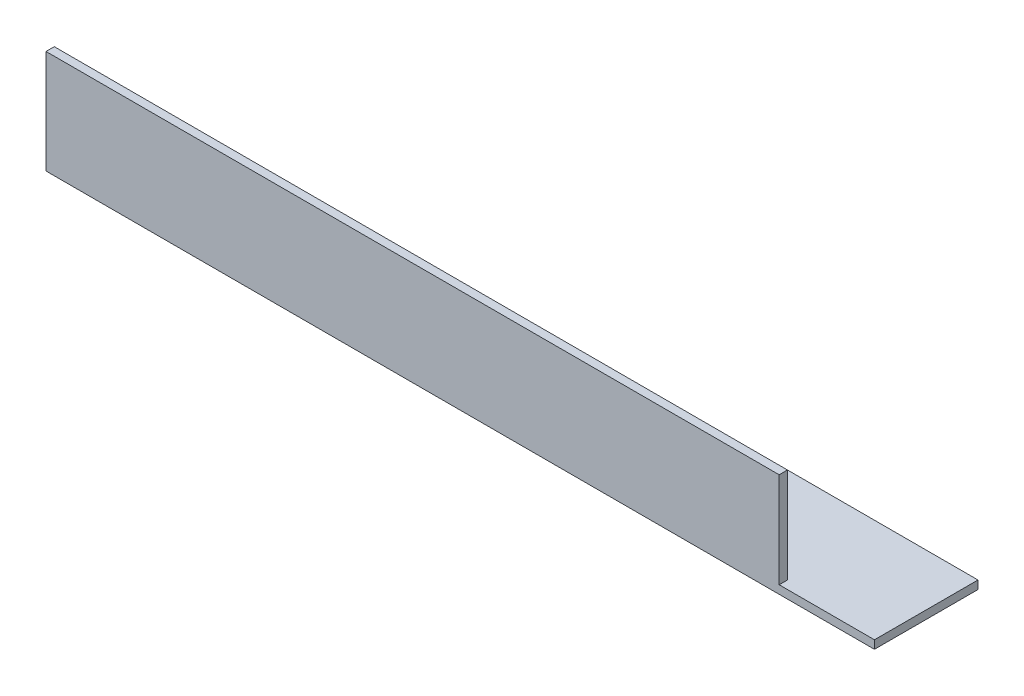
from build123d import *

# Parameters (mm, degrees)
EXTRUDE_1_DEPTH     = 200
SKETCH_3_W          = 23
SKETCH_3_H          = 23
CUT_EXTRUDE_1_DEPTH = 204.100960116


with BuildPart() as part:
    # Эскиз1 → Вытянуть-Тонкостенный1 (new body)
    with BuildSketch(Plane(origin=(0, 0, 0), x_dir=(0, 0, -1), z_dir=(1, 0, 0))):
        Polygon((0, 25), (0, 0), (25, 0), (25, 2), (2, 2), (2, 25), align=None)
    extrude(amount=EXTRUDE_1_DEPTH)

    # Эскиз3 → Вырез-Вытянуть1 (cut, through all)
    with BuildSketch(Plane.XY):
        with Locations((188.5, 13.5)):
            Rectangle(SKETCH_3_W, SKETCH_3_H)
    extrude(amount=-CUT_EXTRUDE_1_DEPTH, mode=Mode.SUBTRACT)


solid = part.part
